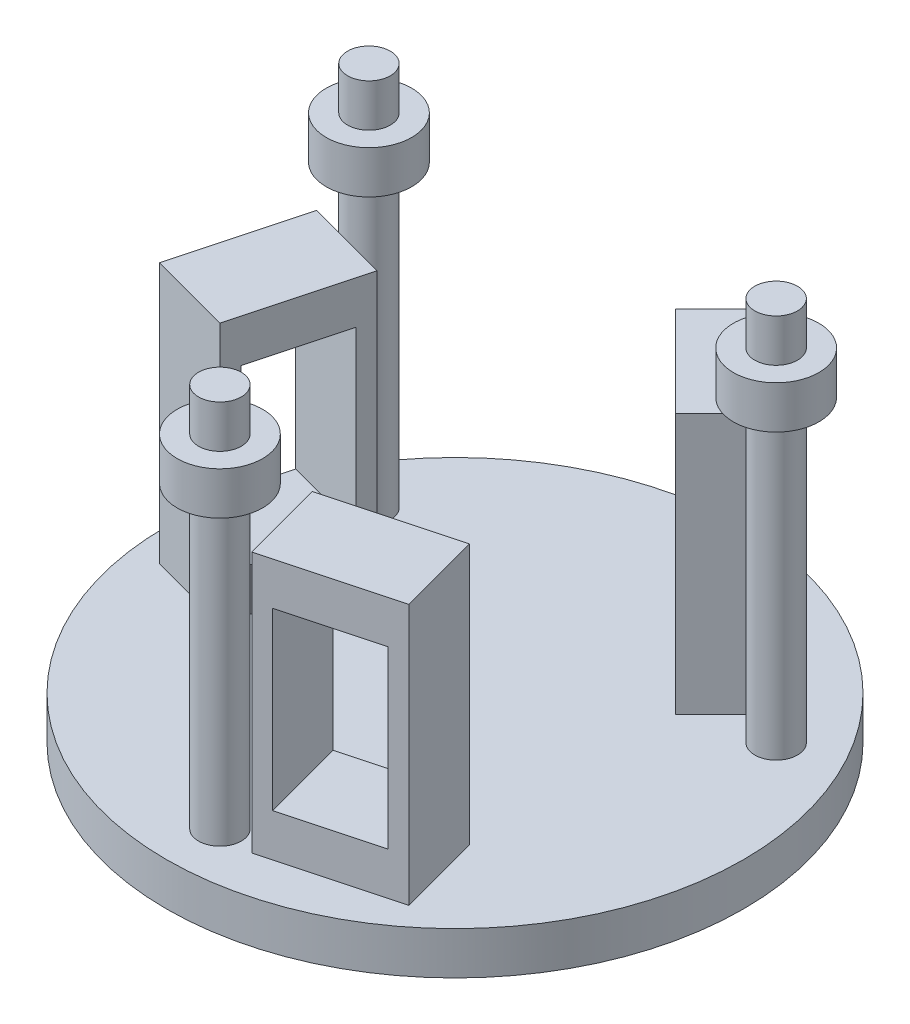
from build123d import *

# Parameters (mm, degrees)
BOSS_EXTRUDE1_OUTLINE_R = 67.5
BOSS_EXTRUDE1_DEPTH     = 10
SKETCH4_R               = 5
BOSS_EXTRUDE2_DEPTH     = 90
BOSS_EXTRUDE3_START     = 70
SKETCH4_3_R             = 10
SKETCH4_3_R_2           = 5
BOSS_EXTRUDE3_DEPTH     = 10
BOSS_EXTRUDE4_DEPTH     = 50
SKETCH6_W               = 30
SKETCH6_H               = 61
SKETCH6_W_2             = 22
SKETCH6_H_2             = 41
BOSS_EXTRUDE5_DEPTH     = 20
SKETCH6_7_W             = 22
SKETCH6_7_H             = 41
BOSS_EXTRUDE6_DEPTH     = 20
SKETCH6_3_W             = 22
SKETCH6_3_H             = 41
CUT_EXTRUDE1_DEPTH      = 166.583644089
CIRPATTERN1_COUNT       = 3


# Read off the part's stored shape, not the designer's step: Boss-Extrude1
with BuildPart() as part:
    # Boss-Extrude1 outline → Boss-Extrude1 (new body)
    with BuildSketch(Plane(origin=(0, 0, 0), x_dir=(1, 0, 0), z_dir=(0, 1, 0))):
        Circle(BOSS_EXTRUDE1_OUTLINE_R)
    extrude(amount=BOSS_EXTRUDE1_DEPTH)

    # Sketch4 → Boss-Extrude2 (add)
    with BuildSketch(Plane(origin=(0, 10, 0), x_dir=(1, 0, 0), z_dir=(0, 1, 0))):
        with Locations(Location((47.631397208, 27.5, 0), (0, 0, 90))):
            Circle(SKETCH4_R)
    boss_extrude2 = extrude(amount=BOSS_EXTRUDE2_DEPTH)

    # Sketch4<3> → Boss-Extrude3 (add)
    with BuildSketch(Plane(origin=(0, 10, 0), x_dir=(1, 0, 0), z_dir=(0, 1, 0)).offset(BOSS_EXTRUDE3_START)):
        with Locations(Location((47.631397208, 27.5, 0), (0, 0, 270))):
            Circle(SKETCH4_3_R)
        with Locations(Location((47.631397208, 27.5, 0), (0, 0, 90))):
            Circle(SKETCH4_3_R_2, mode=Mode.SUBTRACT)
    boss_extrude3 = extrude(amount=BOSS_EXTRUDE3_DEPTH)

    # Sketch5 → Boss-Extrude4 (add)
    with BuildSketch(Plane(origin=(0, 10, 0), x_dir=(1, 0, 0), z_dir=(0, 1, 0))):
        Polygon((12.520884891, 39.12285698), (16.056418797, 42.658390886), (30.19855442, 28.516255262), (26.663020514, 24.980721356), align=None)
    boss_extrude4 = extrude(amount=BOSS_EXTRUDE4_DEPTH)

    # Sketch6 → Boss-Extrude5 (add)
    with BuildSketch(Plane(origin=(25.821870935, 0, -25.821870935), x_dir=(0.7071067811865516, 0, 0.7071067811865435), z_dir=(-0.7071067811865435, 0, 0.7071067811865516))):
        with Locations((-8.810434857, 40.5)):
            Rectangle(SKETCH6_W, SKETCH6_H)
        with Locations((-8.810434857, 40.5)):
            Rectangle(SKETCH6_W_2, SKETCH6_H_2, mode=Mode.SUBTRACT)
    boss_extrude5 = extrude(amount=-BOSS_EXTRUDE5_DEPTH)

    # Sketch6<7> → Boss-Extrude6 (add)
    with BuildSketch(Plane(origin=(25.821870935, 0, -25.821870935), x_dir=(0.7071067811865516, 0, 0.7071067811865435), z_dir=(-0.7071067811865435, 0, 0.7071067811865516))):
        with Locations((-8.810434857, 40.5)):
            Rectangle(SKETCH6_7_W, SKETCH6_7_H)
    extrude(amount=-BOSS_EXTRUDE6_DEPTH)

    # Sketch6<3> → Cut-Extrude1 (cut, through all)
    with BuildSketch(Plane(origin=(25.821870935, 0, -25.821870935), x_dir=(0.7071067811865516, 0, 0.7071067811865435), z_dir=(-0.7071067811865435, 0, 0.7071067811865516))):
        with Locations((-8.810434857, 40.5)):
            Rectangle(SKETCH6_3_W, SKETCH6_3_H)
    cut_extrude1 = extrude(amount=-CUT_EXTRUDE1_DEPTH, mode=Mode.SUBTRACT)

    # CirPattern1: Boss-Extrude2, Boss-Extrude3, Boss-Extrude4, Boss-Extrude5, Cut-Extrude1 ×3 about axis
    cirpattern1_axis = Axis((0, 0, 0), (0, 1, 0))
    add([boss_extrude2.rotate(cirpattern1_axis, i * 360 / CIRPATTERN1_COUNT) for i in range(1, CIRPATTERN1_COUNT)])
    add([boss_extrude3.rotate(cirpattern1_axis, i * 360 / CIRPATTERN1_COUNT) for i in range(1, CIRPATTERN1_COUNT)])
    add([boss_extrude4.rotate(cirpattern1_axis, i * 360 / CIRPATTERN1_COUNT) for i in range(1, CIRPATTERN1_COUNT)])
    add([boss_extrude5.rotate(cirpattern1_axis, i * 360 / CIRPATTERN1_COUNT) for i in range(1, CIRPATTERN1_COUNT)])
    add([cut_extrude1.rotate(cirpattern1_axis, i * 360 / CIRPATTERN1_COUNT) for i in range(1, CIRPATTERN1_COUNT)], mode=Mode.SUBTRACT)


solid = part.part
